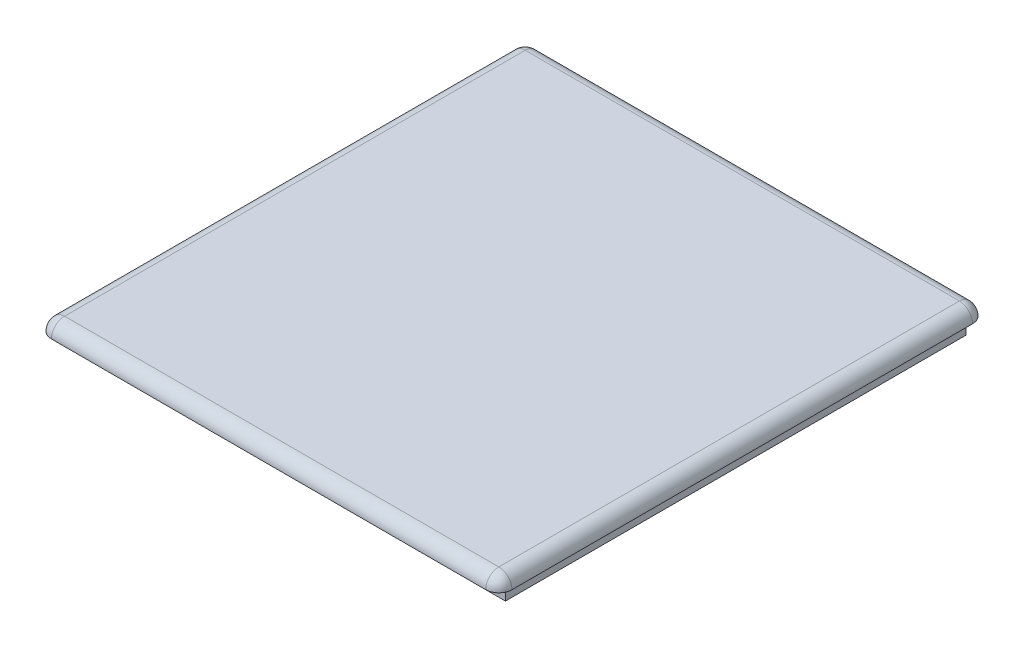
from build123d import *

# Parameters (mm, degrees)
SKETCH_1_W      = 34
SKETCH_1_H      = 35
EXTRUDE_2_DEPTH = 1
SKETCH_3_W      = 35
SKETCH_3_H      = 37
EXTRUDE_3_DEPTH = 1
FILLET_1_R      = 1


with BuildPart() as part:
    # ｽｹｯﾁ1 → ﾎﾞｽ - 押し出し2 (new body)
    with BuildSketch(Plane(origin=(0, 0, 0), x_dir=(1, 0, 0), z_dir=(0, 1, 0))):
        with Locations((0.317073171, 2.724137931)):
            Rectangle(SKETCH_1_W, SKETCH_1_H)
    extrude(amount=EXTRUDE_2_DEPTH)

    # ｽｹｯﾁ3 → ﾎﾞｽ - 押し出し3 (add)
    with BuildSketch(Plane(origin=(0, 1, 0), x_dir=(1, 0, 0), z_dir=(0, 1, 0))):
        with Locations((0.317073171, 2.724137931)):
            Rectangle(SKETCH_3_W, SKETCH_3_H)
    extrude(amount=EXTRUDE_3_DEPTH)

    # ﾌｨﾚｯﾄ1
    fillet_1_edges = [part.edges().sort_by_distance(p)[0] for p in [
        (-17.182926829, 1.5, -21.224137931),
        (-17.182926829, 1.5, 15.775862069),
        (17.817073171, 1.5, 15.775862069),
        (17.817073171, 1.5, -21.224137931),
        (-17.182926829, 2, -2.724137931),
        (0.317073171, 2, 15.775862069),
        (17.817073171, 2, -2.724137931),
        (0.317073171, 2, -21.224137931),
    ]]
    fillet(fillet_1_edges, radius=FILLET_1_R - 0.0001)  # a hair under: the kernel refuses the full size


solid = part.part
